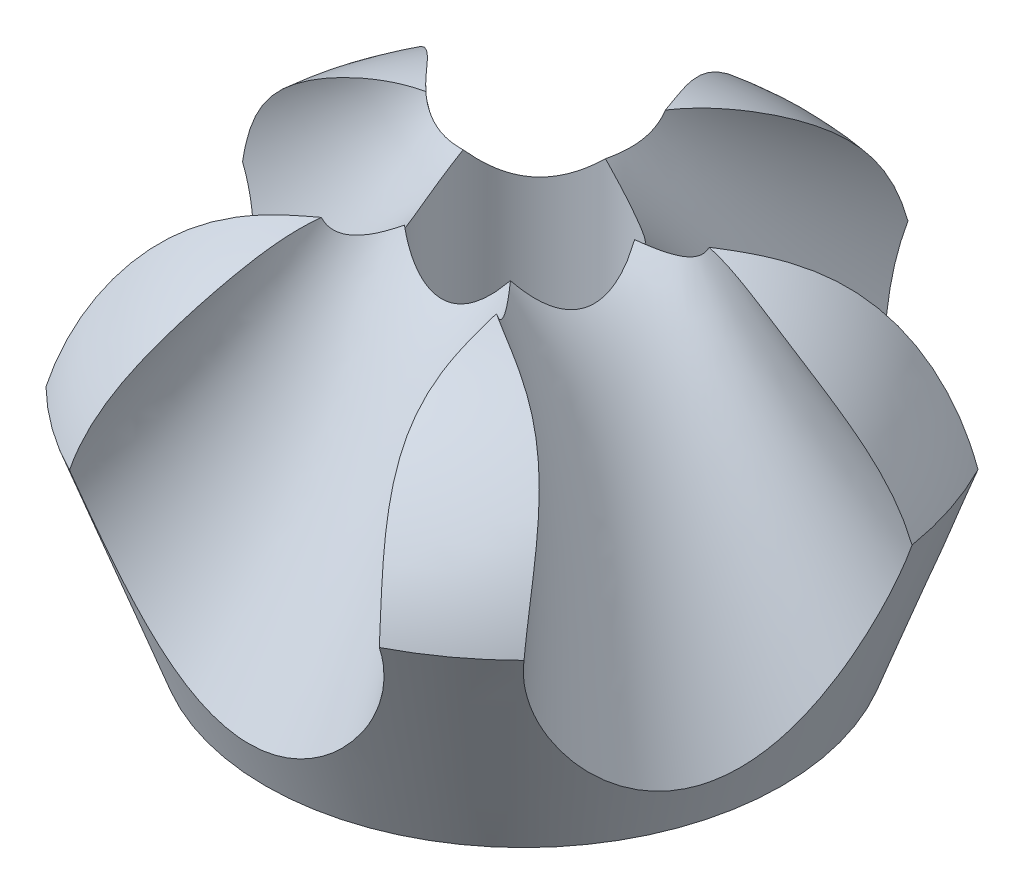
from build123d import *

# Parameters (mm, degrees)
CIRPATTERN1_COUNT       = 5
CUT_EXTRUDE2_DEPTH      = 10
CUT_EXTRUDE2_DEPTH_BACK = 36.38494195
SKETCH11_R              = 1.7
SKETCH13_R              = 5
CUT_EXTRUDE3_DEPTH      = 31.142885247


with BuildPart() as part:
    # Sketch1 → Revolve1 (revolve)
    with BuildSketch(Plane.XY, mode=Mode.PRIVATE) as revolve1_sk:
        with BuildLine():
            Line((0, 0), (-15, 0))
            Line((-15, 0), (-19.617271935, 12.685850381))
            ThreePointArc((-19.617271935, 12.685850381), (-11.701817664, 21.377452363), (0, 20.252363623))
            Line((0, 20.252363623), (0, 13))
            Line((0, 13), (0, 0))
        make_face()
    revolve(revolve1_sk.sketch.rotate(Axis((0, 13, 0), (0, -1, 0)), 270), axis=Axis((0, 13, 0), (0, -1, 0)))

    # Cut-Loft1: read off the stored shape, not the designer's step
    # Cut-Loft1: loft between two sections, ruled curve by curve
    cut_loft1_from = [
        Edge.make_bspline([(-6.436058749, 29.57153688, 0), (-6.435472385, 29.26776658, 0), (-6.413144179, 28.982430705, 0), (-6.340915671, 28.451011544, 0), (-6.28627718, 28.170067162, 0), (-6.125253569, 27.584252896, 0), (-6.01886845, 27.279383013, 0), (-5.739653433, 26.652261846, 0), (-5.566497089, 26.330680636, 0), (-5.138209705, 25.689200079, 0), (-4.882886126, 25.369290167, 0), (-4.280271242, 24.758413009, 0), (-3.932750004, 24.467575785, 0), (-3.1474314, 23.950302258, 0), (-2.709490254, 23.724180364, 0), (-1.762875392, 23.373406588, 0), (-1.254306815, 23.249167019, 0), (-0.205007858, 23.129428379, 0), (0.335322934, 23.134204786, 0), (1.398161254, 23.278661801, 0), (1.920165665, 23.418274028, 0), (2.899441434, 23.81372897, 0), (3.356401226, 24.069199549, 0), (4.175054164, 24.659901932, 0), (4.536756032, 24.994708319, 0), (5.155524833, 25.702820163, 0), (5.412814244, 26.075860992, 0), (5.830524148, 26.825416885, 0), (5.991200935, 27.201868014, 0), (6.232739192, 27.93438877, 0), (6.313783396, 28.290519969, 0), (6.415489633, 28.96941453, 0), (6.436645112, 29.291619256, 0), (6.435472385, 29.899159857, 0), (6.413144179, 30.184495732, 0), (6.340915671, 30.715914893, 0), (6.28627718, 30.996859275, 0), (6.125253569, 31.58267354, 0), (6.01886845, 31.887543424, 0), (5.739653433, 32.514664591, 0), (5.566497089, 32.836245801, 0), (5.138209705, 33.477726357, 0), (4.882886126, 33.79763627, 0), (4.280271242, 34.408513427, 0), (3.932750004, 34.699350652, 0), (3.1474314, 35.216624179, 0), (2.709490254, 35.442746073, 0), (1.762875392, 35.793519849, 0), (1.254306815, 35.917759418, 0), (0.205007858, 36.037498058, 0), (-0.335322934, 36.032721651, 0), (-1.398161254, 35.888264636, 0), (-1.920165665, 35.748652409, 0), (-2.899441434, 35.353197467, 0), (-3.356401226, 35.097726888, 0), (-4.175054164, 34.507024504, 0), (-4.536756032, 34.172218118, 0), (-5.155524833, 33.464106274, 0), (-5.412814244, 33.091065445, 0), (-5.830524148, 32.341509552, 0), (-5.991200935, 31.965058423, 0), (-6.232739192, 31.232537667, 0), (-6.313783396, 30.876406468, 0), (-6.415489633, 30.197511906, 0), (-6.436645112, 29.875307181, 0), (-6.436058749, 29.57153688, 0)], [0.46875, 0.46875, 0.46875, 0.46875, 0.5, 0.5, 0.53125, 0.53125, 0.5625, 0.5625, 0.59375, 0.59375, 0.625, 0.625, 0.65625, 0.65625, 0.6875, 0.6875, 0.71875, 0.71875, 0.75, 0.75, 0.78125, 0.78125, 0.8125, 0.8125, 0.84375, 0.84375, 0.875, 0.875, 0.90625, 0.90625, 0.9375, 0.9375, 0.96875, 0.96875, 1, 1, 1.03125, 1.03125, 1.0625, 1.0625, 1.09375, 1.09375, 1.125, 1.125, 1.15625, 1.15625, 1.1875, 1.1875, 1.21875, 1.21875, 1.25, 1.25, 1.28125, 1.28125, 1.3125, 1.3125, 1.34375, 1.34375, 1.375, 1.375, 1.40625, 1.40625, 1.4375, 1.4375, 1.46875, 1.46875, 1.46875, 1.46875], 3),
    ]
    cut_loft1_to = [
        Edge.make_bspline([(1.312124686, 21.074988591, 22.670668535), (0.849720077, 21.133182993, 22.691849565), (0.41186136, 21.157188184, 22.70058674), (-0.41186136, 21.157188184, 22.70058674), (-0.849720077, 21.133182993, 22.691849565), (-1.774529295, 21.01679419, 22.649487505), (-2.261613099, 20.924355098, 22.615842427), (-3.273803577, 20.646936954, 22.51487048), (-3.799045372, 20.461807237, 22.447488773), (-4.863926151, 19.973985189, 22.269936069), (-5.40362104, 19.671019554, 22.159665595), (-6.457986121, 18.92793524, 21.889205023), (-6.972505992, 18.487462449, 21.728886038), (-7.922206197, 17.464890676, 21.356700351), (-8.356937764, 16.882524955, 21.144736563), (-9.08660218, 15.596911954, 20.676811698), (-9.380885769, 14.893734892, 20.420876178), (-9.780171954, 13.41636016, 19.88315575), (-9.884672635, 12.642680411, 19.601559351), (-9.884672635, 11.094588089, 19.038099826), (-9.780171954, 10.32090834, 18.756503426), (-9.380885769, 8.843533608, 18.218782999), (-9.08660218, 8.140356546, 17.962847479), (-8.356937764, 6.854743545, 17.494922614), (-7.922206197, 6.272377824, 17.282958826), (-6.972505992, 5.249806051, 16.910773138), (-6.457986121, 4.80933326, 16.750454153), (-5.40362104, 4.066248946, 16.479993581), (-4.863926151, 3.763283311, 16.369723108), (-3.799045372, 3.275461263, 16.192170403), (-3.273803577, 3.090331546, 16.124788697), (-2.261613099, 2.812913402, 16.02381675), (-1.774529295, 2.72047431, 15.990171672), (-0.849720077, 2.604085507, 15.947809612), (-0.41186136, 2.580080316, 15.939072437), (0.41186136, 2.580080316, 15.939072437), (0.849720077, 2.604085507, 15.947809612), (1.774529295, 2.72047431, 15.990171672), (2.261613099, 2.812913402, 16.02381675), (3.273803577, 3.090331546, 16.124788697), (3.799045372, 3.275461263, 16.192170403), (4.863926151, 3.763283311, 16.369723108), (5.40362104, 4.066248946, 16.479993581), (6.457986121, 4.80933326, 16.750454153), (6.972505992, 5.249806051, 16.910773138), (7.922206197, 6.272377824, 17.282958826), (8.356937764, 6.854743545, 17.494922614), (9.08660218, 8.140356546, 17.962847479), (9.380885769, 8.843533608, 18.218782999), (9.780171954, 10.32090834, 18.756503426), (9.884672635, 11.094588089, 19.038099826), (9.884672635, 12.642680411, 19.601559351), (9.780171954, 13.41636016, 19.88315575), (9.380885769, 14.893734892, 20.420876178), (9.08660218, 15.596911954, 20.676811698), (8.356937764, 16.882524955, 21.144736563), (7.922206197, 17.464890676, 21.356700351), (6.972505992, 18.487462449, 21.728886038), (6.457986121, 18.92793524, 21.889205023), (5.40362104, 19.671019554, 22.159665595), (4.863926151, 19.973985189, 22.269936069), (3.799045372, 20.461807237, 22.447488773), (3.273803577, 20.646936954, 22.51487048), (2.261613099, 20.924355098, 22.615842427), (1.774529295, 21.01679419, 22.649487505), (1.312124686, 21.074988591, 22.670668535)], [0.46875, 0.46875, 0.46875, 0.46875, 0.5, 0.5, 0.53125, 0.53125, 0.5625, 0.5625, 0.59375, 0.59375, 0.625, 0.625, 0.65625, 0.65625, 0.6875, 0.6875, 0.71875, 0.71875, 0.75, 0.75, 0.78125, 0.78125, 0.8125, 0.8125, 0.84375, 0.84375, 0.875, 0.875, 0.90625, 0.90625, 0.9375, 0.9375, 0.96875, 0.96875, 1, 1, 1.03125, 1.03125, 1.0625, 1.0625, 1.09375, 1.09375, 1.125, 1.125, 1.15625, 1.15625, 1.1875, 1.1875, 1.21875, 1.21875, 1.25, 1.25, 1.28125, 1.28125, 1.3125, 1.3125, 1.34375, 1.34375, 1.375, 1.375, 1.40625, 1.40625, 1.4375, 1.4375, 1.46875, 1.46875, 1.46875, 1.46875], 3),
    ]
    cut_loft1 = Solid(Shell([*[Face.make_surface_from_curves(cut_loft1_from[k], cut_loft1_to[k]) for k in range(1)], Face(Wire(cut_loft1_from)), Face(Wire(cut_loft1_to))]))
    add(cut_loft1, mode=Mode.SUBTRACT)

    # CirPattern1: Cut-Loft1 ×5 about axis
    cirpattern1_axis = Axis((0, 12.685850381, 0), (0, 1, 0))
    for i in range(1, CIRPATTERN1_COUNT):
        add(cut_loft1.rotate(cirpattern1_axis, i * 360 / CIRPATTERN1_COUNT), mode=Mode.SUBTRACT)

    # Sketch11 → Cut-Extrude2 (cut, two sides: drawn at the far end of the back side and taken through both)
    with BuildSketch(Plane(origin=(0, 0, 0), x_dir=(1, 0, 0), z_dir=(0, 1, 0)).offset(-CUT_EXTRUDE2_DEPTH_BACK)):
        with Locations(Location((0, 0, 0), (0, 0, 270))):
            Circle(SKETCH11_R)
    extrude(amount=CUT_EXTRUDE2_DEPTH + CUT_EXTRUDE2_DEPTH_BACK, mode=Mode.SUBTRACT)

    # Sketch13 → Cut-Extrude3 (cut, through all)
    with BuildSketch(Plane.XZ.offset(-10)):
        with Locations(Location((0, 0, 0), (0, 0, 270))):
            Circle(SKETCH13_R)
    extrude(amount=-CUT_EXTRUDE3_DEPTH, mode=Mode.SUBTRACT)


solid = part.part
